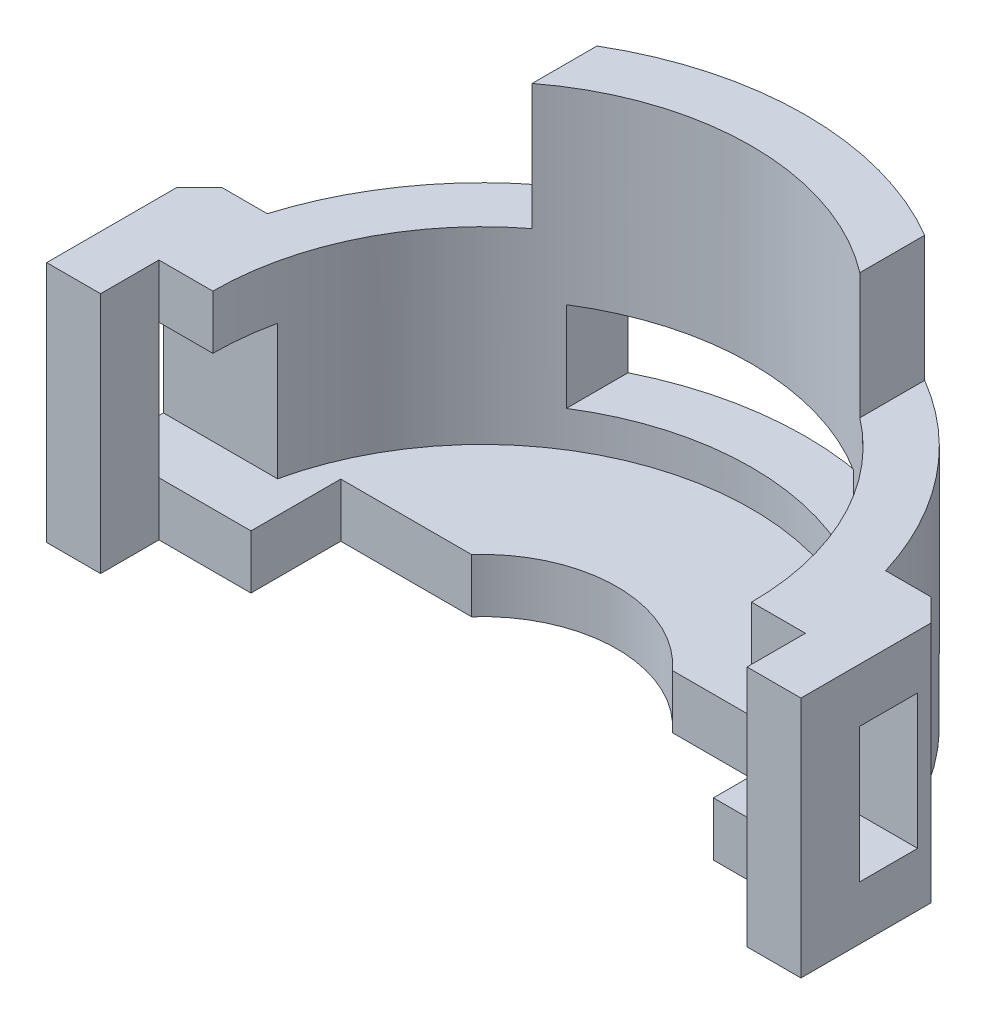
from build123d import *

# Parameters (mm, degrees)
SKETCH1_W                 = 6
SKETCH1_H                 = 1.2
SKETCH1_W_2               = 1.2
SKETCH1_H_2               = 4.2
REVOLVE1_ANGLE            = 180
REVOLVE2_START            = 4.2
REVOLVE2_DEPTH            = 2.8
SKETCH4_W                 = 6.4
SKETCH4_H                 = 2
CUT_EXTRUDE1_DEPTH        = 10
CUT_EXTRUDE2_DEPTH        = 10
BOSS_EXTRUDE6_DEPTH       = 1.2
SKETCH12_W                = 2
SKETCH12_H                = 2.1
BOSS_EXTRUDE15_DEPTH      = 5.4
SKETCH13_W                = 1.3
SKETCH13_H                = 3
CUT_EXTRUDE4_DEPTH        = 4
CUT_EXTRUDE5_DEPTH        = 4
CUT_EXTRUDE5_DEPTH_BACK   = 4
SKETCH14_W                = 1.3
SKETCH14_H                = 3
BOSS_EXTRUDE16_DEPTH      = 2.3
BOSS_EXTRUDE16_DEPTH_BACK = 0.1
SKETCH15_W                = 3.4
SKETCH15_H                = 5.4
SKETCH15_W_2              = 1.3
SKETCH15_H_2              = 3
SKETCH16_W                = 1.2
SKETCH16_H                = 1.3
CUT_EXTRUDE6_DEPTH        = 13.310970717
CHAMFER2_SIZE             = 0.5


# Read off the part's stored shape, not the designer's step: Revolve2
with BuildPart() as part:
    # Sketch1 → Revolve1 (revolve)
    with BuildSketch(Plane.XY):
        with Locations((3, -0.6)):
            Rectangle(SKETCH1_W, SKETCH1_H)
        with Locations((6.6, -0.6)):
            Rectangle(SKETCH1_W_2, SKETCH1_H)
        with Locations((6.6, 2.1)):
            Rectangle(SKETCH1_W_2, SKETCH1_H_2)
    revolve(axis=Axis((0, -1.2, 0), (0, 1, 0)), revolution_arc=REVOLVE1_ANGLE)

    # Revolve2 outline → Revolve2 (add)
    with BuildSketch(Plane(origin=(0, 0, 0), x_dir=(1, 0, 0), z_dir=(0, 1, 0)).offset(REVOLVE2_START)):
        with BuildLine():
            ThreePointArc((3.65, 6.206246853), (0, 7.2), (-3.65, 6.206246853))
            Line((-3.65, 6.206246853), (-3.65, 4.762089877))
            ThreePointArc((-3.65, 4.762089877), (0, 6), (3.65, 4.762089877))
            Line((3.65, 4.762089877), (3.65, 6.206246853))
        make_face()
    extrude(amount=REVOLVE2_DEPTH)

    # Sketch4 → Cut-Extrude1 (cut)
    with BuildSketch(Plane.XY):
        with Locations((0, 1.8)):
            Rectangle(SKETCH4_W, SKETCH4_H)
    extrude(amount=-CUT_EXTRUDE1_DEPTH, mode=Mode.SUBTRACT)

    # Sketch5 → Cut-Extrude2 (cut)
    with BuildSketch(Plane(origin=(0, 0, 0), x_dir=(1, 0, 0), z_dir=(0, 1, 0))):
        with BuildLine():
            Line((-5.15, 2), (-5.15, 0))
            Line((-5.15, 0), (-3, 0))
            ThreePointArc((-3, 0), (-2.802517077, 1.070466269), (-2.236067977, 2))
            Line((-2.236067977, 2), (-5.15, 2))
        make_face()
        with BuildLine():
            ThreePointArc((-2.236067977, 2), (-2.802517077, 1.070466269), (-3, 0))
            Line((-3, 0), (3, 0))
            ThreePointArc((3, 0), (2.802517077, 1.070466269), (2.236067977, 2))
            Line((2.236067977, 2), (-2.236067977, 2))
        make_face()
        with BuildLine():
            Line((-5.15, 0), (-5.15, -2))
            Line((-5.15, -2), (-2.236067977, -2))
            ThreePointArc((-2.236067977, -2), (-2.802517077, -1.070466269), (-3, 0))
            Line((-3, 0), (-5.15, 0))
        make_face()
        with BuildLine():
            ThreePointArc((-3, 0), (-2.802517077, -1.070466269), (-2.236067977, -2))
            Line((-2.236067977, -2), (2.236067977, -2))
            ThreePointArc((2.236067977, -2), (2.802517077, -1.070466269), (3, 0))
            Line((3, 0), (-3, 0))
        make_face()
        with BuildLine():
            ThreePointArc((2.236067977, 2), (0, 3), (-2.236067977, 2))
            Line((-2.236067977, 2), (2.236067977, 2))
        make_face()
        with BuildLine():
            ThreePointArc((2.236067977, 2), (2.802517077, 1.070466269), (3, 0))
            Line((3, 0), (5.15, 0))
            Line((5.15, 0), (5.15, 2))
            Line((5.15, 2), (2.236067977, 2))
        make_face()
        with BuildLine():
            ThreePointArc((3, 0), (2.802517077, -1.070466269), (2.236067977, -2))
            Line((2.236067977, -2), (5.15, -2))
            Line((5.15, -2), (5.15, 0))
            Line((5.15, 0), (3, 0))
        make_face()
    extrude(amount=-CUT_EXTRUDE2_DEPTH, mode=Mode.SUBTRACT)



with BuildPart() as body_2:
    # Sketch9 → Boss-Extrude6 (new body)
    with BuildSketch(Plane(origin=(-7.2, 0, 0), x_dir=(0, 0, -1), z_dir=(1, 0, 0))):
        Polygon((2.1, -1.2), (2.1, 4.2), (0, 4.2), (0, 3), (1.3, 3), (1.3, 0), (0, 0), (0, -1.2), align=None)
        Polygon((0, 3), (0, 4.2), (-1.3, 4.2), (-1.3, -1.2), (0, -1.2), (0, 0), align=None)
    extrude(amount=-BOSS_EXTRUDE6_DEPTH)


with BuildPart() as part_1:
    add(part.part)

    add(body_2.part)  # Boss-Extrude15 merges body 2
    # Sketch12 → Boss-Extrude15 (add)
    with BuildSketch(Plane(origin=(0, 4.2, 0), x_dir=(1, 0, 0), z_dir=(0, 1, 0))):
        with Locations((-7, 1.05)):
            Rectangle(SKETCH12_W, SKETCH12_H)
    extrude(amount=-BOSS_EXTRUDE15_DEPTH)

    # Sketch13 → Cut-Extrude4 (cut)
    with BuildSketch(Plane.ZY.offset(8.4)):
        with Locations((-0.65, 1.5)):
            Rectangle(SKETCH13_W, SKETCH13_H)
    extrude(amount=-CUT_EXTRUDE4_DEPTH, mode=Mode.SUBTRACT)

    # Sketch14 → Cut-Extrude5 (cut, two sides: drawn at the far end of the back side and taken through both)
    with BuildSketch(Plane(origin=(6.1, 0, 0), x_dir=(0, 0, -1), z_dir=(1, 0, 0)).offset(-CUT_EXTRUDE5_DEPTH_BACK)):
        with Locations((0.65, 1.5)):
            Rectangle(SKETCH14_W, SKETCH14_H)
    extrude(amount=CUT_EXTRUDE5_DEPTH + CUT_EXTRUDE5_DEPTH_BACK, mode=Mode.SUBTRACT)

    # Sketch15 → Boss-Extrude16 (add, two sides: drawn at the far end of the back side and taken through both)
    with BuildSketch(Plane(origin=(6.1, 0, 0), x_dir=(0, 0, -1), z_dir=(1, 0, 0)).offset(-BOSS_EXTRUDE16_DEPTH_BACK)):
        with Locations((0.4, 1.5)):
            Rectangle(SKETCH15_W, SKETCH15_H)
        with Locations((0.65, 1.5)):
            Rectangle(SKETCH15_W_2, SKETCH15_H_2, mode=Mode.SUBTRACT)
    extrude(amount=BOSS_EXTRUDE16_DEPTH + BOSS_EXTRUDE16_DEPTH_BACK)

    # Sketch16 → Cut-Extrude6 (cut, through all)
    with BuildSketch(Plane(origin=(0, 4.2, 0), x_dir=(1, 0, 0), z_dir=(0, 1, 0))):
        with Locations((6.6, -0.65)):
            Rectangle(SKETCH16_W, SKETCH16_H)
    extrude(amount=-CUT_EXTRUDE6_DEPTH, mode=Mode.SUBTRACT)

    # Chamfer2
    chamfer2_edges = [part_1.edges().sort_by_distance(p)[0] for p in [
        (-8.4, 1.5, -2.1),
        (8.4, 1.5, -2.1),
    ]]
    chamfer(chamfer2_edges, length=CHAMFER2_SIZE)


solid = part_1.part
